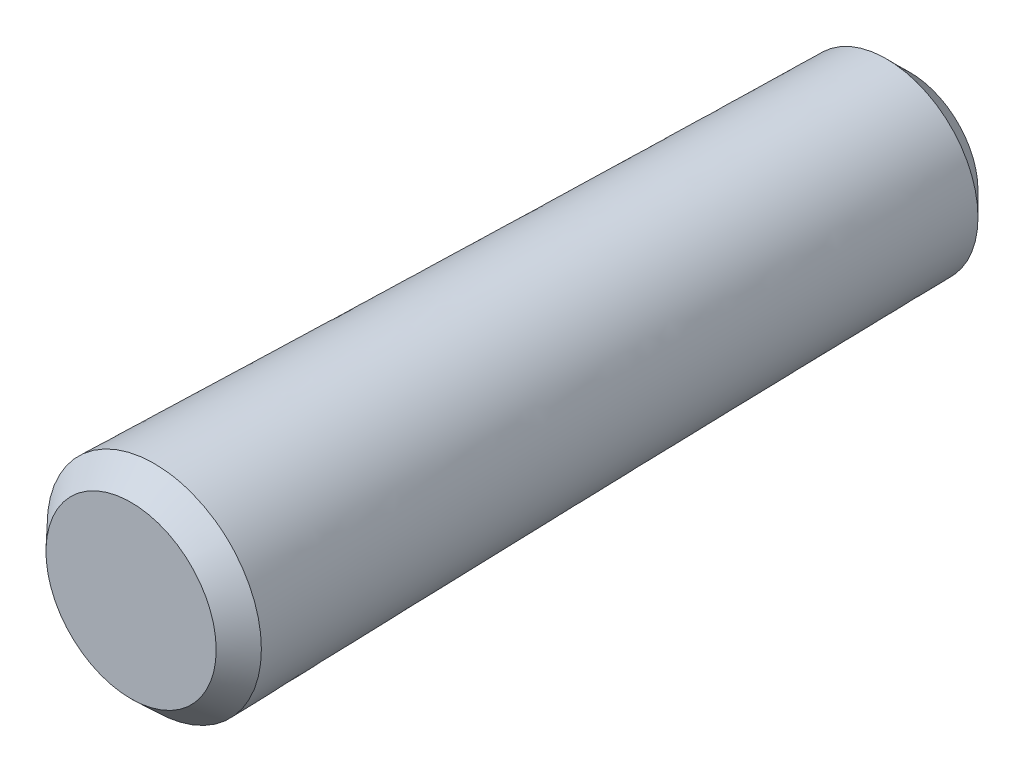
from build123d import *

# Parameters (mm, degrees)
CHAMFER_1_SIZE   = 0.7
CHAMFER_1_SIZE_2 = 0.682306239


with BuildPart() as part:
    # 로프트1: read off the stored shape, not the designer's step
    # 로프트1: loft between two sections, ruled curve by curve
    loft_1_from = [
        Edge.make_bspline([(-1.913760191, -1.974847319, 0), (2.035934447, -5.8023677, 0), (5.863454828, -1.852673062, 0), (1.913760191, 1.974847319, 0), (-2.035934447, 5.8023677, 0), (-5.863454828, 1.852673062, 0), (-1.913760191, -1.974847319, 0)], [0, 0, 0, 0, 0.5, 0.5, 0.5, 1, 1, 1, 1], 3, [1, 0.333333333, 0.333333333, 1, 0.333333333, 0.333333333, 1]),
    ]
    loft_1_to = [
        Edge.make_bspline([(-1.489283496, -2.888690822, 23.5), (4.288098148, -5.867257815, 23.5), (7.266665141, -0.08987617, 23.5), (1.489283496, 2.888690822, 23.5), (-4.288098148, 5.867257815, 23.5), (-7.266665141, 0.08987617, 23.5), (-1.489283496, -2.888690822, 23.5)], [0, 0, 0, 0, 0.5, 0.5, 0.5, 1, 1, 1, 1], 3, [1, 0.333333333, 0.333333333, 1, 0.333333333, 0.333333333, 1]),
    ]
    loft_1 = Solid(Shell([*[Face.make_surface_from_curves(loft_1_from[k], loft_1_to[k]) for k in range(1)], Face(Wire(loft_1_from)), Face(Wire(loft_1_to))]))
    add(loft_1)

    # 모따기1
    # the kernel refuses this chamfer: 0.711000351, 0.7, 0.682306239 mm, written as the material it takes off along each edge
    with BuildSketch(Plane(origin=(0, 0, 0), x_dir=(-0.6959127966509282, -0.7181262977063881, 0), z_dir=(-0.7181262977063881, 0.6959127966509282, 0))) as chamfer_1_piece_1:
        with BuildLine():
            Line((2.761065576, 0.711065576), (2.75 - CHAMFER_1_SIZE, 0))
            Line((2.75 - CHAMFER_1_SIZE, 0), (2.75, 0))
            ThreePointArc((2.75, 0), (2.75565509, 0.365742485), (2.761065576, 0.711065576))
        make_face()
    revolve(axis=Axis((0, 0, 0), (0, 0, 1)), mode=Mode.SUBTRACT)
    with BuildSketch(Plane(origin=(0, 0, 23.5), x_dir=(-0.458241075757006, -0.8888279453803543, 1.0931426705212666e-15), z_dir=(-0.8888279453803543, 0.458241075757006, 0))) as chamfer_1_piece_2:
        with BuildLine():
            Line((3.231690288, -0.699847458), (3.25 - CHAMFER_1_SIZE_2, 0))
            Line((3.25 - CHAMFER_1_SIZE_2, 0), (3.25, 0))
            ThreePointArc((3.25, 0), (3.240564435, -0.35982053), (3.231690288, -0.699847458))
        make_face()
    revolve(axis=Axis((0, 0, 23.5), (0, 0, 1)), mode=Mode.SUBTRACT)


solid = part.part
